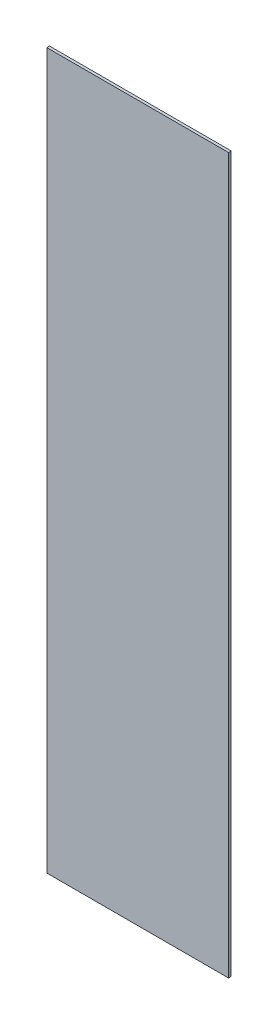
from build123d import *

# Parameters (mm, degrees)
SKETCH1_W           = 155
SKETCH1_H           = 609.6
BOSS_EXTRUDE1_DEPTH = 2.305


with BuildPart() as part:
    # Sketch1 → Boss-Extrude1 (new body)
    with BuildSketch(Plane.XY):
        Rectangle(SKETCH1_W, SKETCH1_H)
    extrude(amount=BOSS_EXTRUDE1_DEPTH)


solid = part.part
